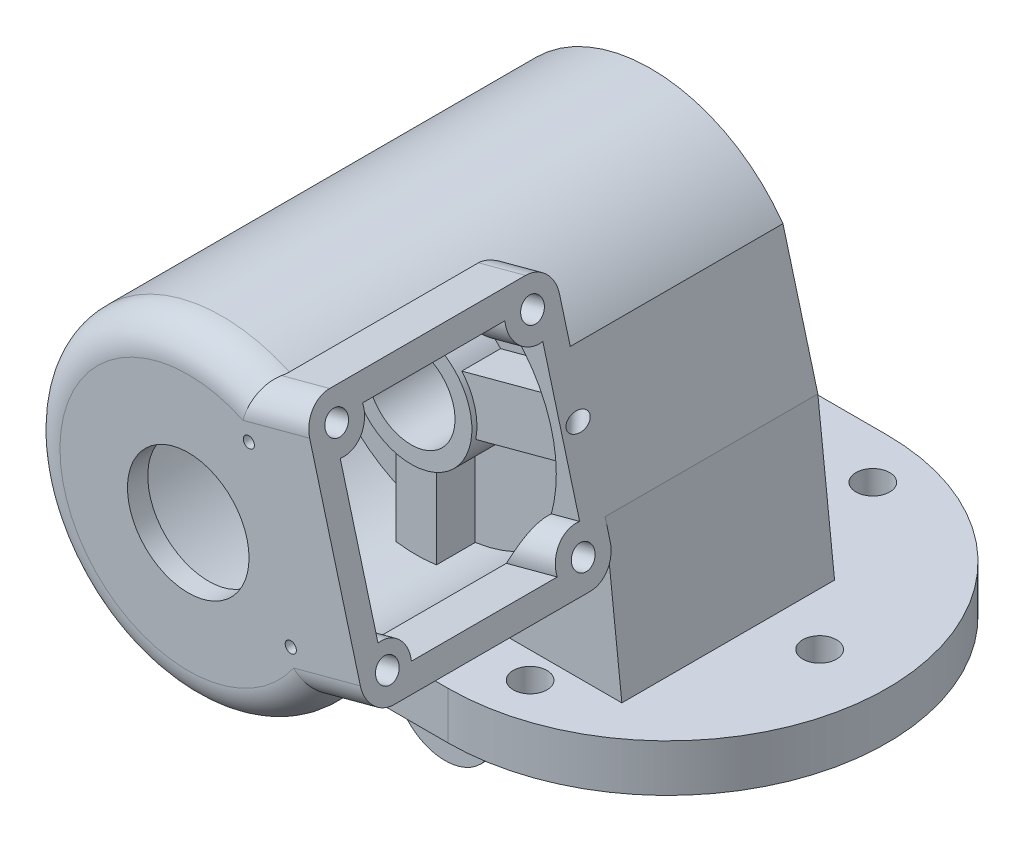
from build123d import *

# Parameters (mm, degrees)
EXTRUDE_1_DEPTH            = 14
EXTRUDE_START              = -45
EXTRUDE_2_DEPTH            = 63
SKETCH_3_R                 = 48
EXTRUDE_3_DEPTH            = 74
SKETCH_4_W                 = 31.4
SKETCH_4_H                 = 35.548471132
EXTRUDE_4_DEPTH            = 12
RIB_1_REACH                = 190.979
SKETCH_5_WALL_W            = 420.744186968
SKETCH_5_WALL_H            = 8
SKETCH_6_W                 = 114
SKETCH_6_H                 = 56
CUT_EXTRUDE_1_DEPTH        = 3
CUT_EXTRUDE_START          = -6
CUT_EXTRUDE_2_DEPTH        = 42
EXTRUDE_5_DEPTH            = 3
EXTRUDE_5_DEPTH_BACK       = 11
SKETCH_8_R                 = 20
HOLE_WIZARD_M30_1_D        = 26.5
HOLE_WIZARD_M30_1_DEPTH    = 14
EXTRUDE_6_DEPTH            = 18
EXTRUDE_7_DEPTH            = 5
CUT_EXTRUDE_3_REACH        = 220.229
SKETCH_13_R                = 5
CUT_EXTRUDE_4_DEPTH        = 8
SKETCH_15_R                = 7.5
EXTRUDE_8_DEPTH            = 13
PATTERN_LINEAR_1_COUNT     = 2
PATTERN_LINEAR_1_PITCH     = 69
HOLE_WIZARD_M6_1_OUTLINE_W = 2.5
HOLE_WIZARD_M6_1_OUTLINE_H = 7.929101258
CUT_EXTRUDE_START_2        = -79
SKETCH_17_R                = 42
CUT_EXTRUDE_5_DEPTH        = 73
EXTRUDE_9_DEPTH            = 4
EXTRUDE_9_DEPTH_BACK       = 23
SKETCH_18_R                = 18
CUT_EXTRUDE_6_REACH        = 177.137
SKETCH_19_R                = 13
CUT_EXTRUDE_7_REACH        = 236.836
SKETCH_20_R                = 18
FILLET_1_R                 = 10
SKETCH_21_W                = 12
SKETCH_21_H                = 28.141800189
EXTRUDE_1_2_DEPTH          = 11.5
EXTRUDE_2_2_DEPTH          = 11.5
CUT_EXTRUDE_START_3        = -134.141433926
CUT_EXTRUDE_8_DEPTH        = 134.141433926
EXTRUDE_10_REACH           = 218.369
HOLE_WIZARD_M8_1_D         = 6.8
HOLE_WIZARD_M8_1_DEPTH     = 12
HOLE_WIZARD_M8_1_TIP       = 2.042926105
CUT_EXTRUDE_9_REACH        = 218.369
CUT_EXTRUDE_9_END_RADIUS   = 42
SWEEP_1_PROFILE_R          = 2.5
HOLE_WIZARD_M4_1_D         = 3.3
HOLE_WIZARD_M4_1_DEPTH     = 6
F_10_0MM_1_D               = 10
F_10_0MM_1_DEPTH           = 14
F_10_0MM_2_OUTLINE_R       = 5
F_10_0MM_2_DEPTH           = 14


# Read off the part's stored shape, not the designer's step: M6 螺纹孔1, 切除-拉伸8, Ø10.0mm 暗销孔2
with BuildPart() as part:
    # 草图1 → Extrude 1 (new body)
    with BuildSketch(Plane(origin=(0, 0, 0), x_dir=(1, 0, 0), z_dir=(0, 1, 0))):
        with BuildLine():
            Line((-25, 65), (25, 65))
            ThreePointArc((25, 65), (90, 0), (25, -65))
            Line((25, -65), (-25, -65))
            ThreePointArc((-25, -65), (-90, 0), (-25, 65))
        make_face()
    extrude(amount=EXTRUDE_1_DEPTH)

    # 草图2 → Extrude 2 (add)
    with BuildSketch(Plane(origin=(0, 0, -65), x_dir=(-1, 0, 0), z_dir=(0, 0, -1)).offset(EXTRUDE_START)):
        with BuildLine():
            Line((54.421993775, 14), (47.714535981, 75.227146074))
            ThreePointArc((47.714535981, 75.227146074), (0, 118), (-47.714535981, 75.227146074))
            Line((-47.714535981, 75.227146074), (-54.421993775, 14))
            Line((-54.421993775, 14), (54.421993775, 14))
        make_face()
    extrude(amount=-EXTRUDE_2_DEPTH)

    # 草图3 → 凸台-拉伸3 (add)
    with BuildSketch(Plane.XY.offset(43)):
        with Locations(Location((0, 70, 0), (0, 0, 180))):
            Circle(SKETCH_3_R)
    extrude(amount=EXTRUDE_3_DEPTH)

    # 草图4 → 凸台-拉伸4 (add)
    with BuildSketch(Plane.XY.offset(65)):
        with Locations((0, 20.446244078)):
            Rectangle(SKETCH_4_W, SKETCH_4_H)
    extrude(amount=-EXTRUDE_4_DEPTH)

    # 草图5 wall → 筋1 (add, up to next)
    with BuildSketch(Plane(origin=(0, 13.75, 83.65), x_dir=(0, 0.404545449326, 0.914517894538), z_dir=(0, -0.914517894538, 0.404545449326)), mode=Mode.PRIVATE) as rib_1_sk1:
        Rectangle(SKETCH_5_WALL_W, SKETCH_5_WALL_H)
    rib_1_tool1 = extrude(rib_1_sk1.sketch, amount=-RIB_1_REACH, mode=Mode.PRIVATE) - part.part
    add(rib_1_tool1.solids().sort_by_distance((0, 13.75, 83.65))[0])

    # 草图6 → 切除-拉伸1 (cut)
    with BuildSketch(Plane.XZ):
        Rectangle(SKETCH_6_W, SKETCH_6_H)
    extrude(amount=-CUT_EXTRUDE_1_DEPTH, mode=Mode.SUBTRACT)

    # 草图7 → 切除-拉伸2 (cut)
    with BuildSketch(Plane(origin=(0, 0, -20), x_dir=(-1, 0, 0), z_dir=(0, 0, -1)).offset(CUT_EXTRUDE_START)):
        with BuildLine():
            Line((-53.189982793, -29.850920636), (53.186970605, -29.823424726))
            Line((53.186970605, -29.823424726), (41.750218984, 74.573752815))
            ThreePointArc((41.750218984, 74.573752815), (0, 112), (-41.750218984, 74.573752815))
            Line((-41.750218984, 74.573752815), (-53.189982793, -29.850920636))
        make_face()
    extrude(amount=-CUT_EXTRUDE_2_DEPTH, mode=Mode.SUBTRACT)

    # 草图8 → 凸台-拉伸5 (add, two sides: drawn at the far end of the back side and taken through both)
    with BuildSketch(Plane(origin=(0, 0, -20), x_dir=(-1, 0, 0), z_dir=(0, 0, -1)).offset(-EXTRUDE_5_DEPTH_BACK)):
        with Locations((0, 70)):
            Circle(SKETCH_8_R)
    extrude(amount=EXTRUDE_5_DEPTH + EXTRUDE_5_DEPTH_BACK)

    # M30 螺纹孔1
    with Locations(Plane(origin=(0, 0, -23), x_dir=(-1, 0, 0), z_dir=(0, 0, -1))):
        with Locations((0, 70)):
            Hole(HOLE_WIZARD_M30_1_D / 2, depth=HOLE_WIZARD_M30_1_DEPTH)

    # 草图11 → 凸台-拉伸6 (add)
    with BuildSketch(Plane(origin=(0, 0, -20), x_dir=(-1, 0, 0), z_dir=(0, 0, -1))):
        with BuildLine():
            Line((-29.75, 14), (29.75, 14))
            Line((29.75, 14), (29.75, 31.8))
            ThreePointArc((29.75, 31.8), (25.356601718, 42.406601718), (14.75, 46.8))
            Line((14.75, 46.8), (-14.75, 46.8))
            ThreePointArc((-14.75, 46.8), (-25.356601718, 42.406601718), (-29.75, 31.8))
            Line((-29.75, 31.8), (-29.75, 14))
        make_face()
    extrude(amount=EXTRUDE_6_DEPTH)

    # 草图12 → 凸台-拉伸7 (add)
    with BuildSketch(Plane(origin=(0, 0, -38), x_dir=(-1, 0, 0), z_dir=(0, 0, -1))):
        with BuildLine():
            Line((-4.5, 14), (4.5, 14))
            Line((4.5, 14), (4.5, 17.889204686))
            ThreePointArc((4.5, 17.889204686), (0, 39.45), (-4.5, 17.889204686))
            Line((-4.5, 17.889204686), (-4.5, 14))
        make_face()
    extrude(amount=EXTRUDE_7_DEPTH)

    # 草图13 → 切除-拉伸3 (cut, up to next)
    with BuildSketch(Plane(origin=(0, 0, -43), x_dir=(-1, 0, 0), z_dir=(0, 0, -1)), mode=Mode.PRIVATE) as cut_extrude_3_sk1:
        with Locations((0, 28.2)):
            Circle(SKETCH_13_R)
    cut_extrude_3_tool1 = extrude(cut_extrude_3_sk1.sketch, amount=-CUT_EXTRUDE_3_REACH, mode=Mode.PRIVATE) & part.part
    add(cut_extrude_3_tool1.solids().sort_by_distance((0, 28.2, -43))[0], mode=Mode.SUBTRACT)

    # 草图14 → 切除-拉伸4 (cut)
    with BuildSketch(Plane.XY.offset(-14)):
        with BuildLine():
            Line((20, 21.2), (20, -6.500152228))
            ThreePointArc((20, -6.500152228), (0, -26.500152228), (-20, -6.500152228))
            Line((-20, -6.500152228), (-20, 21.2))
            ThreePointArc((-20, 21.2), (0, 41.2), (20, 21.2))
        make_face()
    extrude(amount=-CUT_EXTRUDE_4_DEPTH, mode=Mode.SUBTRACT)

    # 草图15 → 凸台-拉伸8 (add)
    with BuildSketch(Plane(origin=(0, 0, 28), x_dir=(-1, 0, 0), z_dir=(0, 0, -1))):
        with BuildLine():
            Line((-25, 0), (25, 0))
            Line((25, 0), (25, -2))
            Line((25, -2), (12.774103205, -21.862715009))
            ThreePointArc((12.774103205, -21.862715009), (0, -29), (-12.774103205, -21.862715009))
            Line((-12.774103205, -21.862715009), (-25, -2))
            Line((-25, -2), (-25, 0))
        make_face()
        with Locations((0, -14)):
            Circle(SKETCH_15_R, mode=Mode.SUBTRACT)
    extrude_8 = extrude(amount=-EXTRUDE_8_DEPTH)

    # 阵列(线性)1: 凸台-拉伸8 ×2
    with Locations(*[(0, 0, -i * PATTERN_LINEAR_1_PITCH) for i in range(1, PATTERN_LINEAR_1_COUNT)]):
        add(extrude_8)

    # M6 螺纹孔1 outline → M6 螺纹孔1 (revolve, cut)
    with BuildSketch(Plane.XY.offset(-34.5)):
        with Locations((1.25, -25.035562725)):
            Rectangle(HOLE_WIZARD_M6_1_OUTLINE_W, HOLE_WIZARD_M6_1_OUTLINE_H)
    revolve(axis=Axis((0, 0, -34.5), (0, 1, 0)), mode=Mode.SUBTRACT)

    # 草图17 → 切除-拉伸5 (cut)
    with BuildSketch(Plane.XY.offset(117).offset(CUT_EXTRUDE_START_2)):
        with Locations((0, 70)):
            Circle(SKETCH_17_R)
    extrude(amount=CUT_EXTRUDE_5_DEPTH, mode=Mode.SUBTRACT)

    # 草图18 → 凸台-拉伸9 (add, two sides: drawn at the far end of the back side and taken through both)
    with BuildSketch(Plane(origin=(0, 0, 28), x_dir=(-1, 0, 0), z_dir=(0, 0, -1)).offset(-EXTRUDE_9_DEPTH_BACK)):
        with Locations((0, 70)):
            Circle(SKETCH_18_R)
    extrude(amount=EXTRUDE_9_DEPTH + EXTRUDE_9_DEPTH_BACK)

    # 草图19 → 切除-拉伸6 (cut, up to next)
    with BuildSketch(Plane(origin=(0, 0, 24), x_dir=(-1, 0, 0), z_dir=(0, 0, -1)), mode=Mode.PRIVATE) as cut_extrude_6_sk1:
        with Locations((0, 70)):
            Circle(SKETCH_19_R)
    cut_extrude_6_tool1 = extrude(cut_extrude_6_sk1.sketch, amount=-CUT_EXTRUDE_6_REACH, mode=Mode.PRIVATE) & part.part
    add(cut_extrude_6_tool1.solids().sort_by_distance((0, 70, 24))[0], mode=Mode.SUBTRACT)

    # 草图20 → 切除-拉伸7 (cut, up to next)
    with BuildSketch(Plane.XY.offset(117), mode=Mode.PRIVATE) as cut_extrude_7_sk1:
        with Locations(Location((0, 70, 0), (0, 0, 180))):
            Circle(SKETCH_20_R)
    cut_extrude_7_tool1 = extrude(cut_extrude_7_sk1.sketch, amount=-CUT_EXTRUDE_7_REACH, mode=Mode.PRIVATE) & part.part
    add(cut_extrude_7_tool1.solids().sort_by_distance((0, 70, 117))[0], mode=Mode.SUBTRACT)

    # 圆角1
    fillet_1_edges = [part.edges().sort_by_distance(p)[0] for p in [
        (48, 70, 117),
    ]]
    fillet(fillet_1_edges, radius=FILLET_1_R)

    # 草图21 → Extrude 1 2 (add)
    with BuildSketch(Plane.XY.offset(38)):
        Polygon((14.938907374, 67.791211084), (42.121798975, 75.074844937), (39.015970434, 86.665954852), (11.833078833, 79.382321), align=None)
        with Locations((0, 42.070900095)):
            Rectangle(SKETCH_21_W, SKETCH_21_H)
        Polygon((-10.97032724, 80.37793921), (-37.414969213, 90.003001744), (-41.519210933, 78.726690295), (-15.07456896, 69.101627761), align=None)
    extrude(amount=EXTRUDE_1_2_DEPTH)

    # 草图23 → Extrude 2 2 (add)
    with BuildSketch(Plane.XY.offset(49.5)):
        Polygon((17.381352519, 66.375109928), (19.457217234, 66.931336202), (42.639437065, 73.142993284), (38.498332343, 88.597806505), (15.316112512, 82.386149422), (13.240247798, 81.829923148), align=None)
    extrude(amount=-EXTRUDE_2_2_DEPTH)

    # 切除-拉伸8 outline → 切除-拉伸8 (cut)
    with BuildSketch(Plane(origin=(0, 0, -20), x_dir=(-1, 0, 0), z_dir=(0, 0, -1)).offset(CUT_EXTRUDE_START_3)):
        with BuildLine():
            Line((-47.714535981, 75.227146074), (-49.462733762, 59.26921325))
            Line((-49.462733762, 59.26921325), (-39.143531816, 97.780999208))
            ThreePointArc((-39.143531816, 97.780999208), (-44.869255155, 87.0513912), (-47.714535981, 75.227146074))
        make_face()
    extrude(amount=CUT_EXTRUDE_8_DEPTH, mode=Mode.SUBTRACT)

    # 草图25 → 凸台-拉伸10 (add, up to next)
    with BuildSketch(Plane(origin=(60.966662183, 16.335967897, 0), x_dir=(0, 0, -1), z_dir=(0.9659258262890692, 0.2588190451025178, 0)), mode=Mode.PRIVATE) as extrude_10_sk1:
        with BuildLine():
            ThreePointArc((-117, 38.61480784), (-114.656854249, 32.957953591), (-109, 30.61480784))
            Line((-109, 30.61480784), (-51, 30.61480784))
            ThreePointArc((-51, 30.61480784), (-45.343145751, 32.957953591), (-43, 38.61480784))
            Line((-43, 38.61480784), (-43, 44.447766262))
            Line((-43, 44.447766262), (-43, 50.911514751))
            Line((-43, 50.911514751), (-107, 50.911514751))
            add(Edge.make_bspline(
                [(-107, 50.911514751), (-107.238146455, 50.911514751), (-107.476396187, 50.930140769), (-107.712800918, 50.967420915), (-107.945779669, 51.022700302), (-108.174058602, 51.094891335), (-108.396631403, 51.182637143), (-108.612731361, 51.2844254), (-108.976316134, 51.483133158), (-109.127083478, 51.574441829), (-109.273981268, 51.672054497), (-109.416944982, 51.77542474), (-109.555961557, 51.884036588), (-109.691060446, 51.997416906), (-109.822306838, 52.115144651), (-110.164157292, 52.441502485), (-110.367796186, 52.657314384), (-110.56124918, 52.882612691), (-110.745031792, 53.11596676), (-110.919659822, 53.35617684), (-111.085658722, 53.602265298), (-111.24356207, 53.853477504), (-111.580438925, 54.42671004), (-111.755220896, 54.751027296), (-111.919213262, 55.081114031), (-112.073212146, 55.416044415), (-112.217918452, 55.755059834), (-112.353966392, 56.097555284), (-112.481930442, 56.443075999), (-112.797196395, 57.354872046), (-112.972167511, 57.925263944), (-113.129463461, 58.501016229), (-113.270755991, 59.080973172), (-113.397421552, 59.664228605), (-113.510624701, 60.250104474), (-113.61133296, 60.838146985), (-113.818350601, 62.210067306), (-113.915770121, 62.995087243), (-113.994490558, 63.782383975), (-114.055831996, 64.571296891), (-114.100730201, 65.361278647), (-114.129797332, 66.151889534), (-114.143324024, 66.942796651), (-114.138441247, 68.827019587), (-114.105852692, 69.919331373), (-114.043519228, 71.010726736), (-113.950100914, 72.100508313), (-113.823240738, 73.18730141), (-113.659058766, 74.268958142), (-113.452436584, 75.342595931), (-113.088649932, 76.840029609), (-112.974177811, 77.273626671), (-112.850500834, 77.704764485), (-112.716939565, 78.133031961), (-112.572719949, 78.557865205), (-112.416962017, 78.978543498), (-112.24863816, 79.394174593), (-111.941439184, 80.084674713), (-111.809926211, 80.362718569), (-111.67150385, 80.637461359), (-111.525722401, 80.908448331), (-111.372106616, 81.175098179), (-111.210147632, 81.436698263), (-111.039282838, 81.692392267), (-110.719109131, 82.133858524), (-110.573667336, 82.322337921), (-110.422228794, 82.50614666), (-110.264503065, 82.684697569), (-110.100224514, 82.857273287), (-109.929158085, 83.023031431), (-109.751105064, 83.181009764), (-109.457343801, 83.417548875), (-109.346341026, 83.50190899), (-109.232879513, 83.582988677), (-109.116956705, 83.660543323), (-108.998590702, 83.734310155), (-108.877823242, 83.804012987), (-108.754723505, 83.869368287), (-108.439313494, 84.022188215), (-108.243988478, 84.103687623), (-108.04391436, 84.173503246), (-107.839724133, 84.230626543), (-107.632198614, 84.274175298), (-107.422282335, 84.303464526), (-107.211103784, 84.318100928), (-107, 84.318100928)],
                knots=[0, 0, 0, 0, 0, 0, 0, 0, 0, 0.048710404, 0.048710404, 0.048710404, 0.048710404, 0.048710404, 0.048710404, 0.048710404, 0.084708198, 0.084708198, 0.084708198, 0.084708198, 0.084708198, 0.084708198, 0.084708198, 0.145234402, 0.145234402, 0.145234402, 0.145234402, 0.145234402, 0.145234402, 0.145234402, 0.220335908, 0.220335908, 0.220335908, 0.220335908, 0.220335908, 0.220335908, 0.220335908, 0.341875328, 0.341875328, 0.341875328, 0.341875328, 0.341875328, 0.341875328, 0.341875328, 0.502965839, 0.502965839, 0.502965839, 0.502965839, 0.502965839, 0.502965839, 0.502965839, 0.725617242, 0.725617242, 0.725617242, 0.725617242, 0.725617242, 0.725617242, 0.725617242, 0.817012723, 0.817012723, 0.817012723, 0.817012723, 0.817012723, 0.817012723, 0.817012723, 0.879735879, 0.879735879, 0.879735879, 0.879735879, 0.879735879, 0.879735879, 0.879735879, 0.928321875, 0.928321875, 0.928321875, 0.928321875, 0.928321875, 0.928321875, 0.928321875, 0.956803779, 0.956803779, 0.956803779, 0.956803779, 0.956803779, 0.956803779, 0.956803779, 1, 1, 1, 1, 1, 1, 1, 1, 1], degree=8))
            Line((-107, 84.318100929), (-43, 84.318100929))
            Line((-43, 84.318100929), (-43, 96.61480784))
            ThreePointArc((-43, 96.61480784), (-45.343145751, 102.27166209), (-51, 104.61480784))
            Line((-51, 104.61480784), (-109, 104.61480784))
            ThreePointArc((-109, 104.61480784), (-114.656854249, 102.27166209), (-117, 96.61480784))
            Line((-117, 96.61480784), (-117, 38.61480784))
        make_face()
    extrude_10_tool1 = extrude(extrude_10_sk1.sketch, amount=-EXTRUDE_10_REACH, mode=Mode.PRIVATE) - part.part
    add(extrude_10_tool1.solids().sort_by_distance((34.688334, 114.408022, 113.916854))[0])

    # M8 螺纹孔1
    with Locations(Plane(origin=(60.966662183, 16.335967897, 0), x_dir=(0, 0, -1), z_dir=(0.9659258262890692, 0.2588190451025178, 0))):
        with Locations((-109, 96.61480784), (-109, 38.61480784), (-51, 38.61480784), (-51, 96.61480784)):
            Hole(HOLE_WIZARD_M8_1_D / 2, depth=HOLE_WIZARD_M8_1_DEPTH)
            with Locations((0, 0, -(HOLE_WIZARD_M8_1_DEPTH + HOLE_WIZARD_M8_1_TIP / 2))):  # 118° drill point
                Cone(0, HOLE_WIZARD_M8_1_D / 2, HOLE_WIZARD_M8_1_TIP, mode=Mode.SUBTRACT)

    # 切除-拉伸9: up to this cylinder (the profile starts outside it)
    cut_extrude_9_end = Plane(origin=(0, 70, 80.107752), z_dir=(0, 0, 1)) * Cylinder(CUT_EXTRUDE_9_END_RADIUS, 521.738, mode=Mode.PRIVATE)
    # 草图30 → 切除-拉伸9 (cut, up to the surface)
    with BuildSketch(Plane(origin=(60.966662183, 16.335967897, 0), x_dir=(0, 0, -1), z_dir=(0.9659258262890692, 0.2588190451025178, 0)), mode=Mode.PRIVATE) as cut_extrude_9_sk1:
        with BuildLine():
            Line((-102.147582543, 37.61480784), (-58.937253933, 37.61480784))
            ThreePointArc((-58.937253933, 37.61480784), (-56.656854249, 44.27166209), (-50, 46.552061773))
            Line((-50, 46.552061773), (-50, 88.677553907))
            ThreePointArc((-50, 88.677553907), (-56.656854249, 90.957953591), (-58.937253933, 97.61480784))
            Line((-58.937253933, 97.61480784), (-101.062746067, 97.61480784))
            ThreePointArc((-101.062746067, 97.61480784), (-103.343145751, 90.957953591), (-110, 88.677553907))
            Line((-110, 88.677553907), (-110, 45.467225297))
            ThreePointArc((-110, 45.467225297), (-104.10328554, 43.5115223), (-102.147582543, 37.61480784))
        make_face()
    cut_extrude_9_tool1 = extrude(cut_extrude_9_sk1.sketch, amount=-CUT_EXTRUDE_9_REACH, mode=Mode.PRIVATE) - cut_extrude_9_end
    add(cut_extrude_9_tool1.solids().sort_by_distance((43.49455, 81.542777, 80.107752))[0], mode=Mode.SUBTRACT)

    # 切除-扫描1: sweep along a curve in space
    with BuildLine() as sweep_1_path:
        Line((0, 70, 0), (103.431614245, 97.714417509, 107.080286529))
    # 切除-扫描1 profile (on start of the path) → 切除-扫描1 (sweep, cut)
    with BuildSketch(Plane(origin=(0, 70, 0), x_dir=(0.7192545966764075, 0, -0.694746590606862), z_dir=(0.6830127018922153, 0.18301270189222096, 0.707106781186551))):
        Circle(SWEEP_1_PROFILE_R)
    sweep(path=sweep_1_path.line, mode=Mode.SUBTRACT)

    # M4 螺纹孔1
    with Locations(Plane.XY.offset(117)):
        with Locations((30.35980274, 53.288256297), (17.936488575, 99.652695959)):
            Hole(HOLE_WIZARD_M4_1_D / 2, depth=HOLE_WIZARD_M4_1_DEPTH)

    # Ø10.0mm 暗销孔1
    with Locations(Plane(origin=(0, 14, 0), x_dir=(1, 0, 0), z_dir=(0, 1, 0))):
        with Locations((-70, 0), (0, 0), (70, 0)):
            Hole(F_10_0MM_1_D / 2, depth=F_10_0MM_1_DEPTH)

    # Ø10.0mm 暗销孔2 outline → Ø10.0mm 暗销孔2 (cut)
    with BuildSketch(Plane(origin=(0, 0, 0), x_dir=(1, 0, 0), z_dir=(0, 1, 0))):
        with Locations((35, -50.75)):
            Circle(F_10_0MM_2_OUTLINE_R)
        with Locations((-35, 50.75)):
            Circle(F_10_0MM_2_OUTLINE_R)
        with Locations((35, 50.75)):
            Circle(F_10_0MM_2_OUTLINE_R)
        with Locations((-35, -50.75)):
            Circle(F_10_0MM_2_OUTLINE_R)
    extrude(amount=F_10_0MM_2_DEPTH, mode=Mode.SUBTRACT)


solid = part.part
